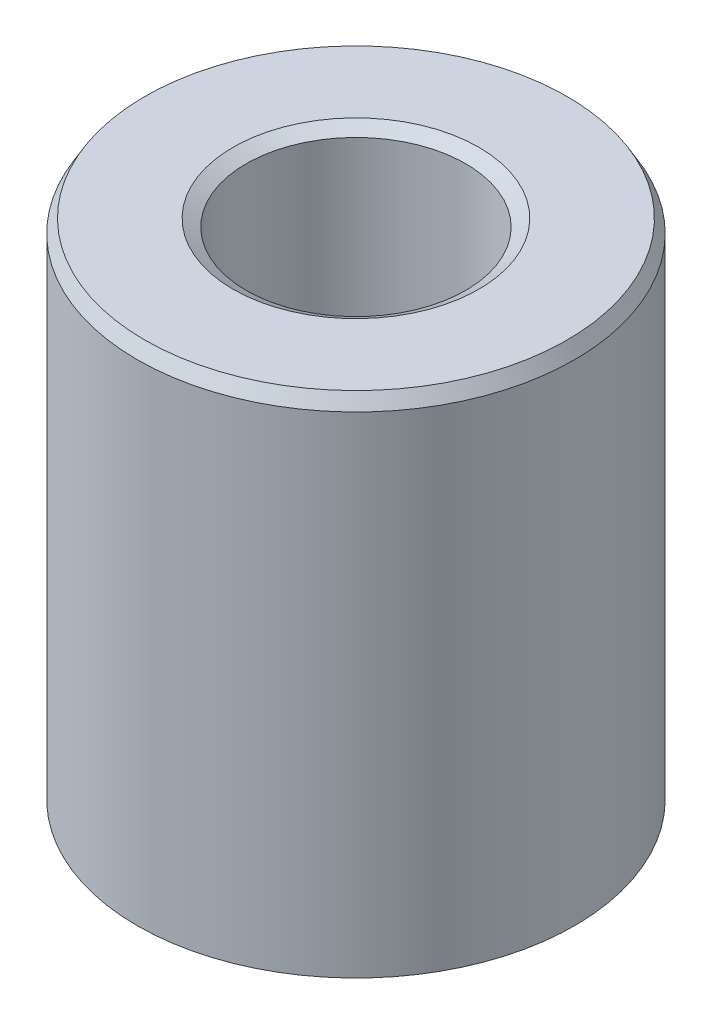
from build123d import *
from OCP.BRepFilletAPI import BRepFilletAPI_MakeChamfer

# Parameters (mm, degrees)
SKETCH1_R           = 45
BOSS_EXTRUDE1_DEPTH = 105.158621995
SKETCH2_R           = 22.588528392
CUT_EXTRUDE1_DEPTH  = 123.915970402
CHAMFER1_SIZE       = 2.71303084
CHAMFER1_SIZE2      = 1.566369086


with BuildPart() as part:
    # Sketch1 → Boss-Extrude1 (new body)
    with BuildSketch(Plane(origin=(0, 0, 0), x_dir=(1, 0, 0), z_dir=(0, 1, 0))):
        Circle(SKETCH1_R)
    extrude(amount=BOSS_EXTRUDE1_DEPTH)

    # Sketch2 → Cut-Extrude1 (cut, through all)
    with BuildSketch(Plane(origin=(0, 0, 0), x_dir=(1, 0, 0), z_dir=(0, 1, 0))):
        Circle(SKETCH2_R)
    extrude(amount=CUT_EXTRUDE1_DEPTH, mode=Mode.SUBTRACT)

    # Chamfer1: one chamfer whose edges measure the first distance from different faces: ONE call of the kernel's chamfer builder (chamfer() names one face for all edges)
    chamfer1_edges_1 = [part.edges().sort_by_distance(p)[0] for p in [
        (-22.588528392, 105.158621995, 0),
    ]]
    chamfer1_side_1 = [part.faces().sort_by_distance(p)[0] for p in [
        (-43.727207794, 105.158621995, 0),
    ]]
    chamfer1_edges_2 = [part.edges().sort_by_distance(p)[0] for p in [
        (-22.588528392, 0, 0),
    ]]
    chamfer1_side_2 = [part.faces().sort_by_distance(p)[0] for p in [
        (-22.588528392, 52.579310998, 0),
    ]]
    chamfer1_edges_3 = [part.edges().sort_by_distance(p)[0] for p in [
        (-45, 0, 0),
    ]]
    chamfer1_side_3 = [part.faces().sort_by_distance(p)[0] for p in [
        (-43.727207794, 0, 0),
    ]]
    chamfer1_edges_4 = [part.edges().sort_by_distance(p)[0] for p in [
        (-45, 105.158621995, 0),
    ]]
    chamfer1_side_4 = [part.faces().sort_by_distance(p)[0] for p in [
        (-45, 52.579310998, 0),
    ]]
    chamfer1 = BRepFilletAPI_MakeChamfer(part.part.solid().wrapped)
    for e in chamfer1_edges_1:
        chamfer1.Add(CHAMFER1_SIZE, CHAMFER1_SIZE2, e.wrapped, chamfer1_side_1[0].wrapped)  # the first distance lies on this face
    for e in chamfer1_edges_2:
        chamfer1.Add(CHAMFER1_SIZE, CHAMFER1_SIZE2, e.wrapped, chamfer1_side_2[0].wrapped)  # the first distance lies on this face
    for e in chamfer1_edges_3:
        chamfer1.Add(CHAMFER1_SIZE, CHAMFER1_SIZE2, e.wrapped, chamfer1_side_3[0].wrapped)  # the first distance lies on this face
    for e in chamfer1_edges_4:
        chamfer1.Add(CHAMFER1_SIZE, CHAMFER1_SIZE2, e.wrapped, chamfer1_side_4[0].wrapped)  # the first distance lies on this face
    add(Compound.cast(chamfer1.Shape()), mode=Mode.REPLACE)


solid = part.part
